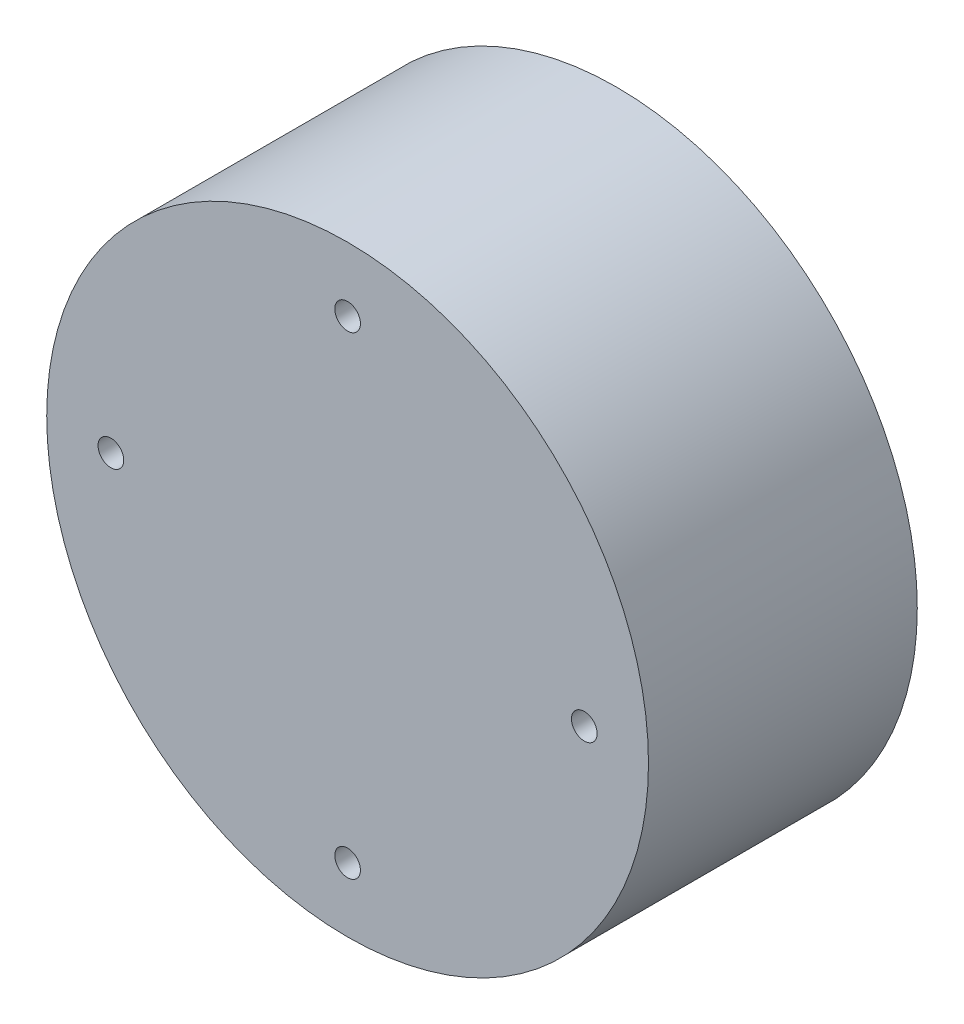
from build123d import *

# Parameters (mm, degrees)
ESQUISSE1_R             = 37.5
BOSS_EXTRU_1_DEPTH      = 33.5
ESQUISSE2_R             = 1.6
ENL_V_MAT_EXTRU_1_DEPTH = 63.727585638


with BuildPart() as part:
    # Esquisse1 → Boss.-Extru.1 (new body)
    with BuildSketch(Plane.XY):
        Circle(ESQUISSE1_R)
    extrude(amount=BOSS_EXTRU_1_DEPTH)

    # Esquisse2 → Enlèv. mat.-Extru.1 (cut, through all)
    with BuildSketch(Plane.XY.offset(33.5)):
        with Locations((0, 29.5)):
            Circle(ESQUISSE2_R)
        with Locations((29.499010186, 0)):
            Circle(ESQUISSE2_R)
        with Locations((-29.500989814, 0)):
            Circle(ESQUISSE2_R)
        with Locations((0, -29.5)):
            Circle(ESQUISSE2_R)
    extrude(amount=-ENL_V_MAT_EXTRU_1_DEPTH, mode=Mode.SUBTRACT)


solid = part.part
